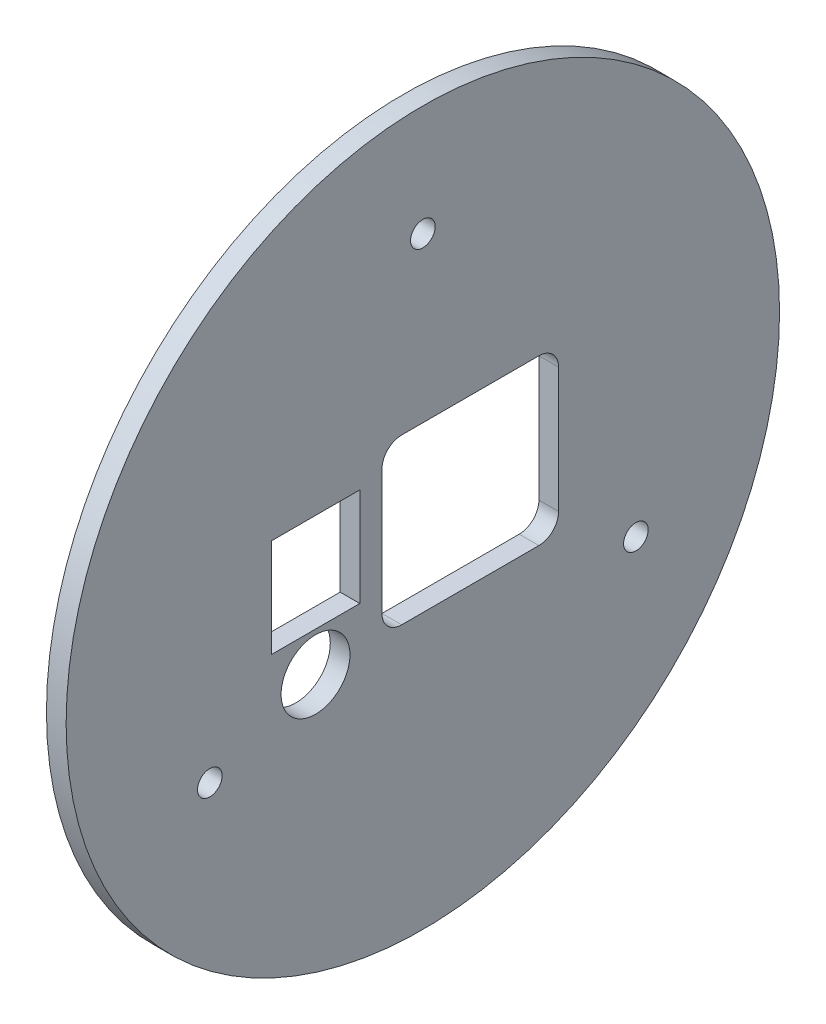
from build123d import *

# Parameters (mm, degrees)
SKETCH1_R           = 72.5
SKETCH1_R_2         = 7
SKETCH1_R_3         = 2.5
SKETCH1_W           = 18
SKETCH1_H           = 20
BOSS_EXTRUDE1_DEPTH = 4


with BuildPart() as part:
    # Sketch1 → Boss-Extrude1 (new body)
    with BuildSketch(Plane(origin=(0, 0, 0), x_dir=(0, 0, -1), z_dir=(1, 0, 0))):
        Circle(SKETCH1_R)
        with Locations((-21.809754717, -16.7)):
            Circle(SKETCH1_R_2, mode=Mode.SUBTRACT)
        with Locations((0, 50)):
            Circle(SKETCH1_R_3, mode=Mode.SUBTRACT)
        with Locations((43.301270189, -25)):
            Circle(SKETCH1_R_3, mode=Mode.SUBTRACT)
        with Locations((-43.301270189, -25)):
            Circle(SKETCH1_R_3, mode=Mode.SUBTRACT)
        with BuildLine():
            Line((-4.309754717, 16.7), (23.590245283, 16.7))
            ThreePointArc((23.590245283, 16.7), (26.418672408, 15.528427125), (27.590245283, 12.7))
            Line((27.590245283, 12.7), (27.590245283, -12.7))
            ThreePointArc((27.590245283, -12.7), (26.418672408, -15.528427125), (23.590245283, -16.7))
            Line((23.590245283, -16.7), (-4.309754717, -16.7))
            ThreePointArc((-4.309754717, -16.7), (-7.138181842, -15.528427125), (-8.309754717, -12.7))
            Line((-8.309754717, -12.7), (-8.309754717, 12.7))
            ThreePointArc((-8.309754717, 12.7), (-7.138181842, 15.528427125), (-4.309754717, 16.7))
        make_face(mode=Mode.SUBTRACT)
        with Locations((-21.809754717, 1.3)):
            Rectangle(SKETCH1_W, SKETCH1_H, mode=Mode.SUBTRACT)
    extrude(amount=BOSS_EXTRUDE1_DEPTH)


solid = part.part
